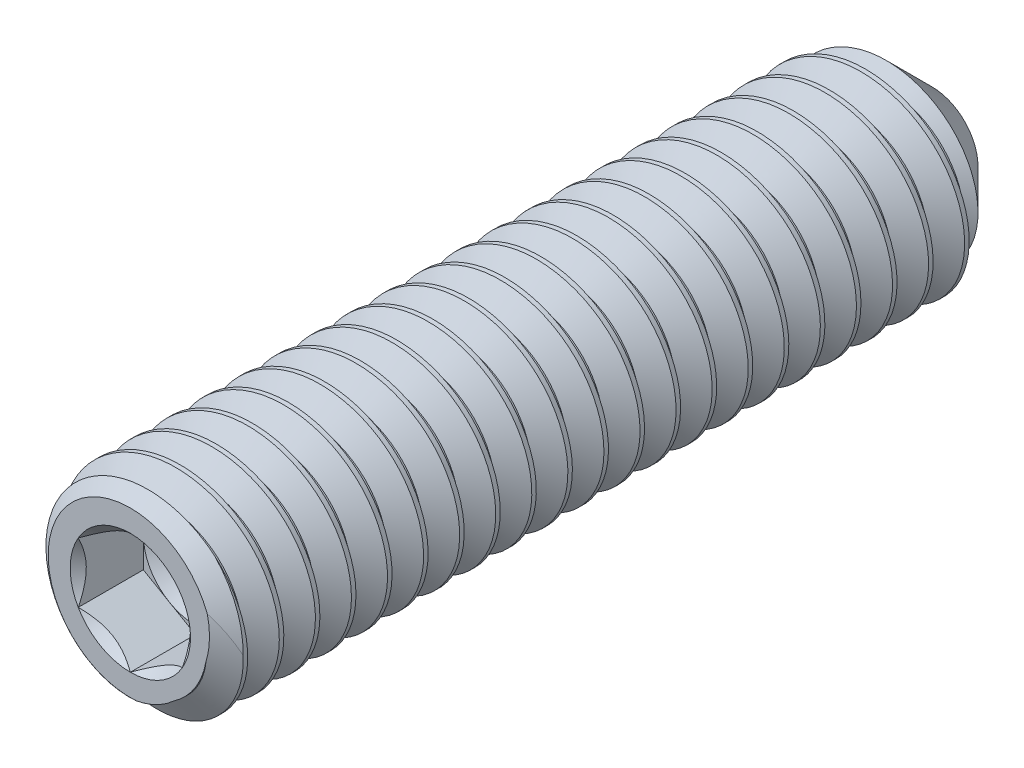
from build123d import *

# Parameters (mm, degrees)
CUT_EXTRUDE1_DEPTH = 0.8125
CUT_SWEEP1_PITCH   = 0.45


with BuildPart() as part:
    # Sketch11 → Revolve1 (revolve)
    with BuildSketch(Plane(origin=(0, 0, 0), x_dir=(0, 0, -1), z_dir=(1, 0, 0)), mode=Mode.PRIVATE) as revolve1_sk:
        Polygon((-5, 0), (-5, 1.025), (-4.842453304, 1.25), (4.325, 1.25), (5, 0.575), (4.654505144, 0), align=None)
    revolve(revolve1_sk.sketch.rotate(Axis((0, 0, -4.654505144), (0, 0, -1)), 180), axis=Axis((0, 0, -4.654505144), (0, 0, -1)))

    # Sketch2 → Cut-Extrude1 (cut)
    with BuildSketch(Plane.XY.offset(5)):
        Polygon((0, 0.75055535), (-0.65, 0.375277675), (-0.65, -0.375277675), (0, -0.75055535), (0.65, -0.375277675), (0.65, 0.375277675), align=None)
    extrude(amount=-CUT_EXTRUDE1_DEPTH, mode=Mode.SUBTRACT)

    # Cut-Extrude2 cone 1 section (through the dimple's axis) → Cut-Extrude2 (revolve, cut)
    with BuildSketch(Plane(origin=(0, 0, 5), x_dir=(0, -1, 0), z_dir=(1, 0, 0))):
        Polygon((0, 0), (0.75055535, 0), (0, 0.75055535), align=None)
    revolve(axis=Axis((0, 0, 5), (0, 0, -1)), mode=Mode.SUBTRACT)

    # Cut-Extrude3 cone 1 section (through the dimple's axis) → Cut-Extrude3 (revolve, cut)
    with BuildSketch(Plane(origin=(0, 0, 4.1875), x_dir=(0, -1, 0), z_dir=(1, 0, 0))):
        Polygon((0, 0), (0.65, 0), (0, 0.375277675), align=None)
    revolve(axis=Axis((0, 0, 4.1875), (0, 0, -1)), mode=Mode.SUBTRACT)

    # Cut-Sweep1: the profile of Sketch6 screwed along a right-hand helix of 24.444444 turns, 6 arcs to a turn; built about Z, then put on its axis
    cut_sweep1_z = Axis((0, 0, 0), (0, 0, 1))
    cut_sweep1_corners = [(1.274356964, 0, 0.0140625), (1.274356964, 0, -0.4078125), (0.957716426, 0, -0.225), (0.957716426, 0, -0.16875)]
    with BuildLine(mode=Mode.PRIVATE) as cut_sweep1_profile:
        Line(cut_sweep1_corners[0], cut_sweep1_corners[1])
        Line(cut_sweep1_corners[1], cut_sweep1_corners[2])
        Line(cut_sweep1_corners[2], cut_sweep1_corners[3])
        Line(cut_sweep1_corners[3], cut_sweep1_corners[0])
    cut_sweep1_cap = Face(cut_sweep1_profile.wire())
    cut_sweep1_turn_angles = [0, 30, 60, 90, 120, 150, 180, 210, 240, 270, 300, 330, 360]
    cut_sweep1_turn_weights = [1, 0.8660254037844387, 1, 0.8660254037844387, 1, 0.8660254037844387, 1, 0.8660254037844387, 1, 0.8660254037844387, 1, 0.8660254037844387, 1]
    cut_sweep1_turn_rails = [Edge.make_bspline([Vector(p[0], p[1], 0).rotate(cut_sweep1_z, cut_sweep1_turn_angles[k]) / cut_sweep1_turn_weights[k] + Vector(0, 0, p[2] + CUT_SWEEP1_PITCH * cut_sweep1_turn_angles[k] / 360) for k in range(13)], [0, 0, 0, 1, 1, 2, 2, 3, 3, 4, 4, 5, 5, 6, 6, 6], 2, cut_sweep1_turn_weights) for p in cut_sweep1_corners]
    cut_sweep1_turn_sides = [Face.make_surface_from_curves(cut_sweep1_turn_rails[p[0]], cut_sweep1_turn_rails[p[1]]) for p in [(0, 1), (1, 2), (2, 3), (3, 0)]]
    cut_sweep1_last_angles = [8640, 8670, 8700, 8730, 8760, 8780, 8800]
    cut_sweep1_last_weights = [1, 0.8660254037844387, 1, 0.8660254037844387, 1, 0.9396926207858269, 1]
    cut_sweep1_last_rails = [Edge.make_bspline([Vector(p[0], p[1], 0).rotate(cut_sweep1_z, cut_sweep1_last_angles[k]) / cut_sweep1_last_weights[k] + Vector(0, 0, p[2] + CUT_SWEEP1_PITCH * cut_sweep1_last_angles[k] / 360) for k in range(7)], [0, 0, 0, 1, 1, 2, 2, 3, 3, 3], 2, cut_sweep1_last_weights) for p in cut_sweep1_corners]
    cut_sweep1_last_sides = [Face.make_surface_from_curves(cut_sweep1_last_rails[p[0]], cut_sweep1_last_rails[p[1]]) for p in [(0, 1), (1, 2), (2, 3), (3, 0)]]
    cut_sweep1 = Plane(origin=(0, 0, -5), x_dir=(0, 1, 0), z_dir=(0, 0, 1)) * Solid(Shell([*[p.moved(Location((0, 0, CUT_SWEEP1_PITCH * i))) for i in range(24) for p in cut_sweep1_turn_sides], *cut_sweep1_last_sides, cut_sweep1_cap, cut_sweep1_cap.rotate(cut_sweep1_z, 8800).moved(Location((0, 0, CUT_SWEEP1_PITCH * 8800 / 360)))]))
    add(cut_sweep1, mode=Mode.SUBTRACT)


solid = part.part
